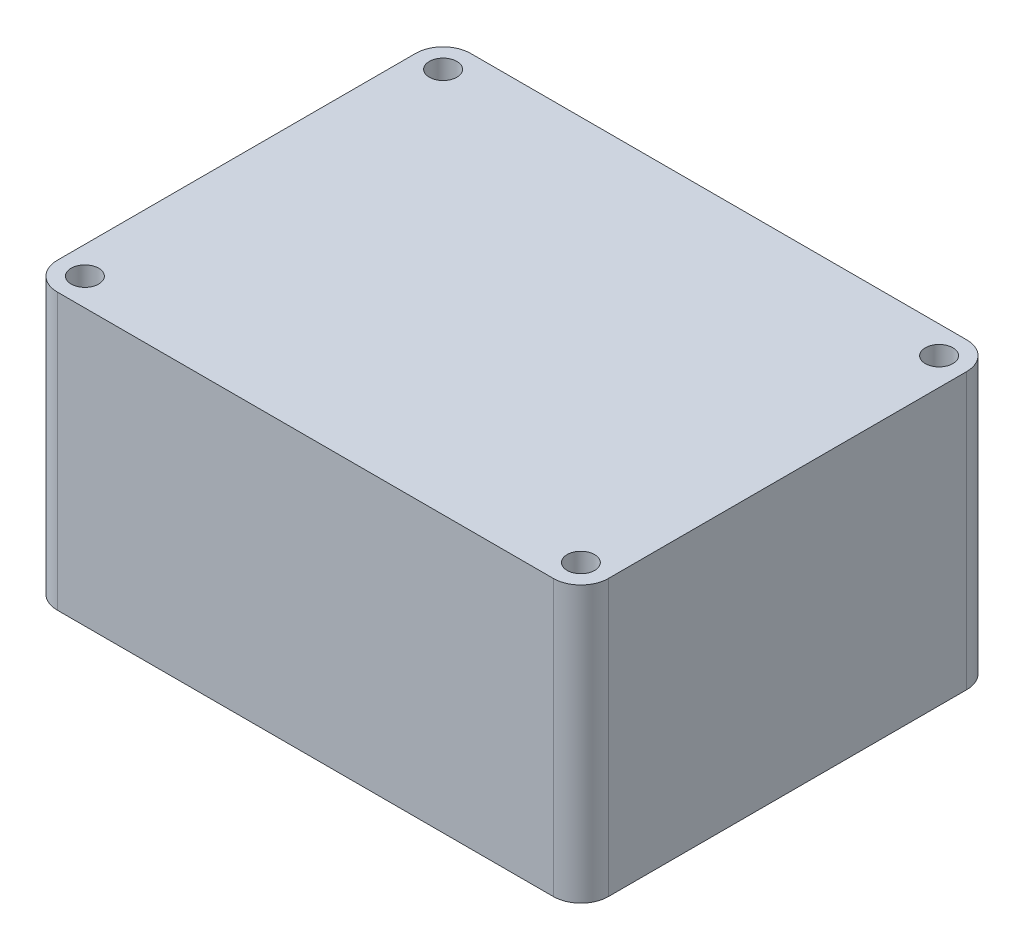
from build123d import *

# Parameters (mm, degrees)
CROQUIS1_W                                 = 200
CROQUIS1_H                                 = 150
SALIENTE_EXTRUIR1_DEPTH                    = 100
REDONDEO1_R                                = 10
CROQUIS2_R                                 = 5
CORTAR_EXTRUIR1_DEPTH                      = 161.078105936
SIMETR_A1_AT_THE_SECOND_PLANE_COPY_1_SKE_R = 5
SIMETR_A1_AT_THE_SECOND_PLANE_COPY_1_DEPTH = 161.078105936


with BuildPart() as part:
    # Croquis1 → Saliente-Extruir1 (new body)
    with BuildSketch(Plane(origin=(0, 0, 0), x_dir=(1, 0, 0), z_dir=(0, 1, 0))):
        Rectangle(CROQUIS1_W, CROQUIS1_H)
    extrude(amount=SALIENTE_EXTRUIR1_DEPTH)

    # Redondeo1
    redondeo1_edges = [part.edges().sort_by_distance(p)[0] for p in [
        (-100, 50, -75),
        (100, 50, -75),
        (100, 50, 75),
        (-100, 50, 75),
    ]]
    fillet(redondeo1_edges, radius=REDONDEO1_R)

    # Croquis2 → Cortar-Extruir1 (cut, through all)
    with BuildSketch(Plane(origin=(0, 100, 0), x_dir=(1, 0, 0), z_dir=(0, 1, 0))):
        with Locations((-90, 65)):
            Circle(CROQUIS2_R)
    cortar_extruir1 = extrude(amount=-CORTAR_EXTRUIR1_DEPTH, mode=Mode.SUBTRACT)

    # Simetría1: Cortar-Extruir1 across plane
    add(cortar_extruir1.mirror(Plane.XY), mode=Mode.SUBTRACT)

    # Simetría1 at the second plane: Cortar-Extruir1 across plane
    add(cortar_extruir1.mirror(Plane(origin=(0, 0, 0), x_dir=(0, 0, 1), z_dir=(1, 0, 0))), mode=Mode.SUBTRACT)

    # Simetría1 at the second plane copy 1 ske → Simetría1 at the second plane copy 1 (cut, through all)
    with BuildSketch(Plane(origin=(0, 100, 0), x_dir=(-1, 0, 0), z_dir=(0, 1, 0))):
        with Locations((-90, 65)):
            Circle(SIMETR_A1_AT_THE_SECOND_PLANE_COPY_1_SKE_R)
    extrude(amount=-SIMETR_A1_AT_THE_SECOND_PLANE_COPY_1_DEPTH, mode=Mode.SUBTRACT)


solid = part.part
